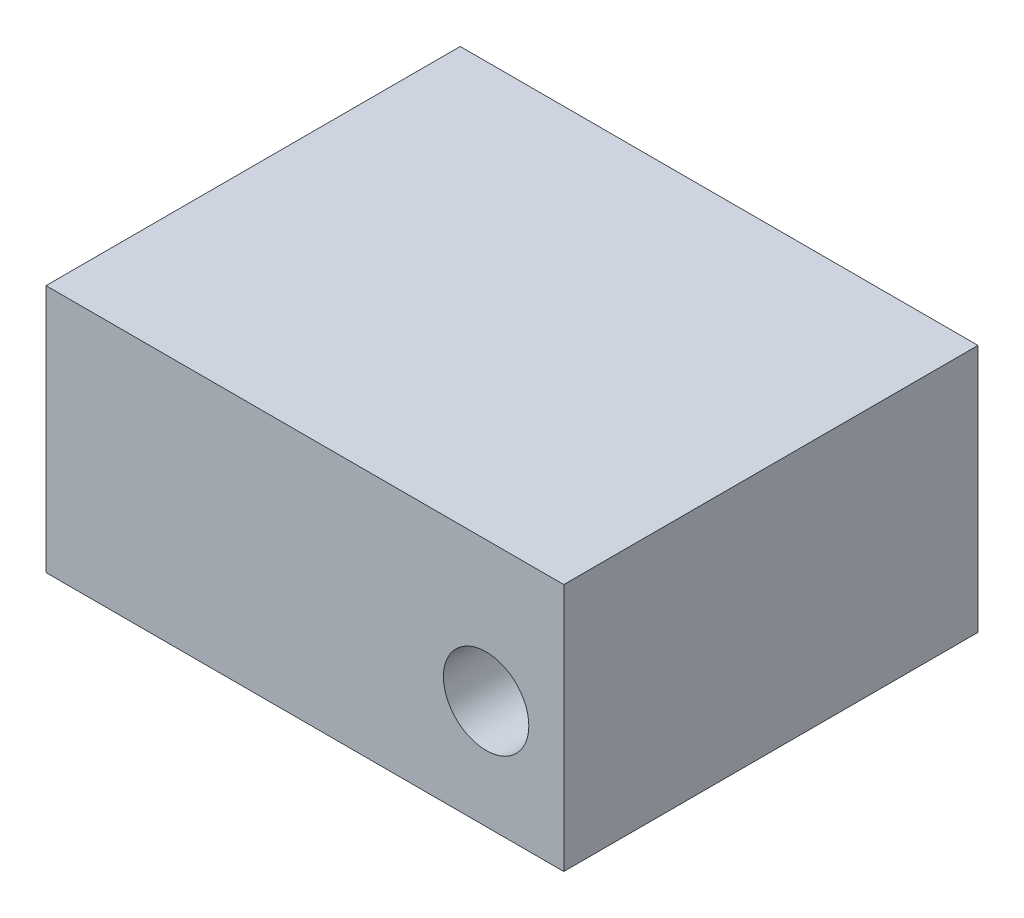
from build123d import *

# Parameters (mm, degrees)
SKETCH1_R           = 1.65
BOSS_EXTRUDE1_DEPTH = 16


with BuildPart() as part:
    # Sketch1 → Boss-Extrude1 (new body)
    with BuildSketch(Plane.XY.offset(60.279798331)):
        Polygon((4, -11.552526313), (20, -11.552526313), (24, -11.552526313), (24, -1.952526313), (4, -1.952526313), align=None)
        with Locations((20.999999999, -7.352525988)):
            Circle(SKETCH1_R, mode=Mode.SUBTRACT)
    extrude(amount=-BOSS_EXTRUDE1_DEPTH)


solid = part.part
